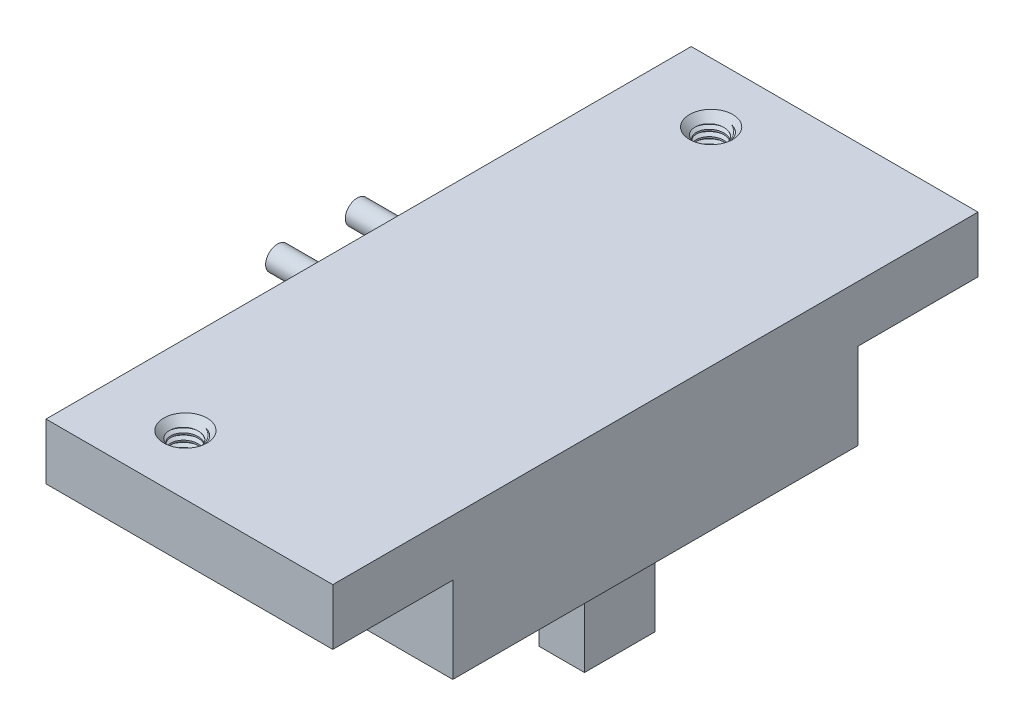
from build123d import *

# Parameters (mm, degrees)
SKETCH1_W                       = 36
SKETCH1_H                       = 81
BOSS_EXTRUDE1_DEPTH             = 5
SKETCH2_W                       = 36
SKETCH2_H                       = 50.86
BOSS_EXTRUDE2_DEPTH             = 3
SKETCH3_R                       = 1.5
BOSS_EXTRUDE3_DEPTH             = 6
SKETCH5_W                       = 36
SKETCH5_H                       = 14.5
BOSS_EXTRUDE4_DEPTH             = 9.85
SKETCH6_W                       = 10
SKETCH6_H                       = 21.86
BOSS_EXTRUDE5_DEPTH             = 9.85
SKETCH7_W                       = 5.7
SKETCH7_H                       = 8.85
BOSS_EXTRUDE6_DEPTH             = 12
SKETCH17_W                      = 36
SKETCH17_H                      = 15.07
BOSS_EXTRUDE7_DEPTH             = 2.05
F_8_32_TAPPED_HOLE2_D           = 3.4544
F_8_32_TAPPED_HOLE2_DEPTH       = 10.962193539
F_8_32_TAPPED_HOLE2_CSINK_D     = 5.4356
F_8_32_TAPPED_HOLE2_CSINK_ANGLE = 90
F_8_32_TAPPED_HOLE2_TIP         = 1.037806461
THREAD4_PITCH                   = 0.79375
THREAD5_PITCH                   = 0.79375


with BuildPart() as part:
    # Sketch1 → Boss-Extrude1 (new body)
    with BuildSketch(Plane(origin=(0, 0, 0), x_dir=(1, 0, 0), z_dir=(0, 1, 0))):
        with Locations((4.166301859, 13.341692271)):
            Rectangle(SKETCH1_W, SKETCH1_H)
    extrude(amount=BOSS_EXTRUDE1_DEPTH)

    # Sketch2 → Boss-Extrude2 (add)
    with BuildSketch(Plane.XZ):
        with Locations((4.166301859, -13.341692271)):
            Rectangle(SKETCH2_W, SKETCH2_H)
    extrude(amount=BOSS_EXTRUDE2_DEPTH)

    # Sketch3 → Boss-Extrude3 (add)
    with BuildSketch(Plane.ZY.offset(13.833698141)):
        with Locations(Location((-17.911692271, 2, 0), (0, 0, 180))):
            Circle(SKETCH3_R)
        with Locations(Location((-7.911692271, 2, 0), (0, 0, 180))):
            Circle(SKETCH3_R)
    extrude(amount=BOSS_EXTRUDE3_DEPTH)

    # Sketch5 → Boss-Extrude4 (add)
    with BuildSketch(Plane.XZ.offset(3)):
        with Locations((4.166301859, -31.521692271)):
            Rectangle(SKETCH5_W, SKETCH5_H)
        with Locations((4.166301859, 4.838307729)):
            Rectangle(SKETCH5_W, SKETCH5_H)
    extrude(amount=BOSS_EXTRUDE4_DEPTH)

    # Sketch6 → Boss-Extrude5 (add)
    with BuildSketch(Plane.XZ.offset(3)):
        with Locations((17.166301859, -13.341692271)):
            Rectangle(SKETCH6_W, SKETCH6_H)
    extrude(amount=BOSS_EXTRUDE5_DEPTH)

    # Sketch7 → Boss-Extrude6 (add)
    with BuildSketch(Plane.XZ.offset(12.85)):
        with Locations((14.829926748, -13.354790469)):
            Rectangle(SKETCH7_W, SKETCH7_H)
    extrude(amount=BOSS_EXTRUDE6_DEPTH)

    # Sketch17 → Boss-Extrude7 (add)
    with BuildSketch(Plane.XZ):
        with Locations((4.166301859, 19.623307729)):
            Rectangle(SKETCH17_W, SKETCH17_H)
        with Locations((4.166301859, -46.306692271)):
            Rectangle(SKETCH17_W, SKETCH17_H)
    extrude(amount=BOSS_EXTRUDE7_DEPTH)

    # #8-32 Tapped Hole2
    with Locations(Plane(origin=(0, 5, 0), x_dir=(1, 0, 0), z_dir=(0, 1, 0))):
        with Locations((-3.833698141, 46.341692271), (-3.833698141, -19.658307729)):
            CounterSinkHole(F_8_32_TAPPED_HOLE2_D / 2, F_8_32_TAPPED_HOLE2_CSINK_D / 2, depth=F_8_32_TAPPED_HOLE2_DEPTH, counter_sink_angle=F_8_32_TAPPED_HOLE2_CSINK_ANGLE)
            with Locations((0, 0, -(F_8_32_TAPPED_HOLE2_DEPTH + F_8_32_TAPPED_HOLE2_TIP / 2))):  # 118° drill point
                Cone(0, F_8_32_TAPPED_HOLE2_D / 2, F_8_32_TAPPED_HOLE2_TIP, mode=Mode.SUBTRACT)

    # Thread4: the profile of Thread Profile10 profile screwed along a right-hand helix of 12.598425 turns, 8 arcs to a turn; built about Z, then put on its axis
    thread4_z = Axis((0, 0, 0), (0, 0, 1))
    thread4_corners = [(1.7269, 0, -0.000173205), (2.156829788, 0, 0.248046874), (2.156829788, 0, 0.347265624), (1.7269, 0, 0.595485703)]
    with BuildLine(mode=Mode.PRIVATE) as thread4_profile:
        Line(thread4_corners[0], thread4_corners[1])
        Line(thread4_corners[1], thread4_corners[2])
        Line(thread4_corners[2], thread4_corners[3])
        Line(thread4_corners[3], thread4_corners[0])
    thread4_cap = Face(thread4_profile.wire())
    thread4_turn_angles = [0, 22.5, 45, 67.5, 90, 112.5, 135, 157.5, 180, 202.5, 225, 247.5, 270, 292.5, 315, 337.5, 360]
    thread4_turn_weights = [1, 0.9238795325112867, 1, 0.9238795325112867, 1, 0.9238795325112867, 1, 0.9238795325112867, 1, 0.9238795325112867, 1, 0.9238795325112867, 1, 0.9238795325112867, 1, 0.9238795325112867, 1]
    thread4_turn_rails = [Edge.make_bspline([Vector(p[0], p[1], 0).rotate(thread4_z, thread4_turn_angles[k]) / thread4_turn_weights[k] + Vector(0, 0, p[2] + THREAD4_PITCH * thread4_turn_angles[k] / 360) for k in range(17)], [0, 0, 0, 1, 1, 2, 2, 3, 3, 4, 4, 5, 5, 6, 6, 7, 7, 8, 8, 8], 2, thread4_turn_weights) for p in thread4_corners]
    thread4_turn_sides = [Face.make_surface_from_curves(thread4_turn_rails[p[0]], thread4_turn_rails[p[1]]) for p in [(0, 1), (1, 2), (2, 3), (3, 0)]]
    thread4_last_angles = [4320, 4342.5, 4365, 4387.5, 4410, 4432.5, 4455, 4477.5, 4500, 4517.716535433, 4535.433070866]
    thread4_last_weights = [1, 0.9238795325112867, 1, 0.9238795325112867, 1, 0.9238795325112867, 1, 0.9238795325112867, 1, 0.9525736983244454, 1]
    thread4_last_rails = [Edge.make_bspline([Vector(p[0], p[1], 0).rotate(thread4_z, thread4_last_angles[k]) / thread4_last_weights[k] + Vector(0, 0, p[2] + THREAD4_PITCH * thread4_last_angles[k] / 360) for k in range(11)], [0, 0, 0, 1, 1, 2, 2, 3, 3, 4, 4, 5, 5, 5], 2, thread4_last_weights) for p in thread4_corners]
    thread4_last_sides = [Face.make_surface_from_curves(thread4_last_rails[p[0]], thread4_last_rails[p[1]]) for p in [(0, 1), (1, 2), (2, 3), (3, 0)]]
    thread4 = Plane(origin=(-3.833698141, 5.0094, -46.341692271), x_dir=(-1, 0, 0), z_dir=(0, -1, 0)) * Solid(Shell([*[p.moved(Location((0, 0, THREAD4_PITCH * i))) for i in range(12) for p in thread4_turn_sides], *thread4_last_sides, thread4_cap, thread4_cap.rotate(thread4_z, 4535.433070866).moved(Location((0, 0, THREAD4_PITCH * 4535.433070866 / 360)))]))
    add(thread4, mode=Mode.SUBTRACT)

    # Thread5: the profile of Thread Profile11 profile screwed along a right-hand helix of 12.598425 turns, 8 arcs to a turn; built about Z, then put on its axis
    thread5_z = Axis((0, 0, 0), (0, 0, 1))
    thread5_corners = [(1.7269, 0, -0.000173205), (2.156829788, 0, 0.248046874), (2.156829788, 0, 0.347265624), (1.7269, 0, 0.595485703)]
    with BuildLine(mode=Mode.PRIVATE) as thread5_profile:
        Line(thread5_corners[0], thread5_corners[1])
        Line(thread5_corners[1], thread5_corners[2])
        Line(thread5_corners[2], thread5_corners[3])
        Line(thread5_corners[3], thread5_corners[0])
    thread5_cap = Face(thread5_profile.wire())
    thread5_turn_angles = [0, 22.5, 45, 67.5, 90, 112.5, 135, 157.5, 180, 202.5, 225, 247.5, 270, 292.5, 315, 337.5, 360]
    thread5_turn_weights = [1, 0.9238795325112867, 1, 0.9238795325112867, 1, 0.9238795325112867, 1, 0.9238795325112867, 1, 0.9238795325112867, 1, 0.9238795325112867, 1, 0.9238795325112867, 1, 0.9238795325112867, 1]
    thread5_turn_rails = [Edge.make_bspline([Vector(p[0], p[1], 0).rotate(thread5_z, thread5_turn_angles[k]) / thread5_turn_weights[k] + Vector(0, 0, p[2] + THREAD5_PITCH * thread5_turn_angles[k] / 360) for k in range(17)], [0, 0, 0, 1, 1, 2, 2, 3, 3, 4, 4, 5, 5, 6, 6, 7, 7, 8, 8, 8], 2, thread5_turn_weights) for p in thread5_corners]
    thread5_turn_sides = [Face.make_surface_from_curves(thread5_turn_rails[p[0]], thread5_turn_rails[p[1]]) for p in [(0, 1), (1, 2), (2, 3), (3, 0)]]
    thread5_last_angles = [4320, 4342.5, 4365, 4387.5, 4410, 4432.5, 4455, 4477.5, 4500, 4517.716535433, 4535.433070866]
    thread5_last_weights = [1, 0.9238795325112867, 1, 0.9238795325112867, 1, 0.9238795325112867, 1, 0.9238795325112867, 1, 0.9525736983244454, 1]
    thread5_last_rails = [Edge.make_bspline([Vector(p[0], p[1], 0).rotate(thread5_z, thread5_last_angles[k]) / thread5_last_weights[k] + Vector(0, 0, p[2] + THREAD5_PITCH * thread5_last_angles[k] / 360) for k in range(11)], [0, 0, 0, 1, 1, 2, 2, 3, 3, 4, 4, 5, 5, 5], 2, thread5_last_weights) for p in thread5_corners]
    thread5_last_sides = [Face.make_surface_from_curves(thread5_last_rails[p[0]], thread5_last_rails[p[1]]) for p in [(0, 1), (1, 2), (2, 3), (3, 0)]]
    thread5 = Plane(origin=(-3.833698141, 5.0094, 19.658307729), x_dir=(-1, 0, 0), z_dir=(0, -1, 0)) * Solid(Shell([*[p.moved(Location((0, 0, THREAD5_PITCH * i))) for i in range(12) for p in thread5_turn_sides], *thread5_last_sides, thread5_cap, thread5_cap.rotate(thread5_z, 4535.433070866).moved(Location((0, 0, THREAD5_PITCH * 4535.433070866 / 360)))]))
    add(thread5, mode=Mode.SUBTRACT)


solid = part.part
